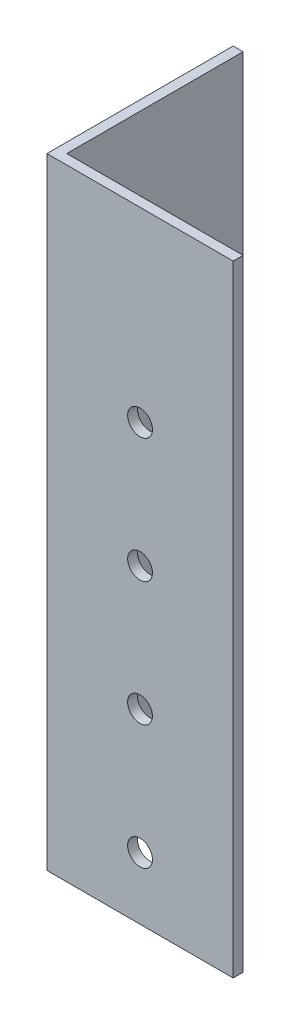
from build123d import *

# Parameters (mm, degrees)
EXTRUDE_1_DEPTH     = 250
SKETCH_6_R          = 5
CUT_EXTRUDE_1_DEPTH = 10
SKETCH_7_R          = 5
CUT_EXTRUDE_2_DEPTH = 10


with BuildPart() as part:
    # Эскиз1 → Вытянуть-Тонкостенный1 (new body)
    with BuildSketch(Plane(origin=(0, 0, 0), x_dir=(1, 0, 0), z_dir=(0, 1, 0))):
        Polygon((0, 75), (0, 0), (75, 0), (75, 4), (4, 4), (4, 75), align=None)
    extrude(amount=EXTRUDE_1_DEPTH)

    # Эскиз6 → Вырез-Вытянуть1 (cut)
    with BuildSketch(Plane.ZY):
        with Locations((-37.5, 25)):
            Circle(SKETCH_6_R)
        with Locations((-37.5, 75)):
            Circle(SKETCH_6_R)
        with Locations((-37.5, 125)):
            Circle(SKETCH_6_R)
        with Locations((-37.5, 175)):
            Circle(SKETCH_6_R)
    extrude(amount=-CUT_EXTRUDE_1_DEPTH, mode=Mode.SUBTRACT)

    # Эскиз7 → Вырез-Вытянуть2 (cut)
    with BuildSketch(Plane.XY):
        with Locations((37.5, 25)):
            Circle(SKETCH_7_R)
        with Locations((37.5, 75)):
            Circle(SKETCH_7_R)
        with Locations((37.5, 125)):
            Circle(SKETCH_7_R)
        with Locations((37.5, 175)):
            Circle(SKETCH_7_R)
    extrude(amount=-CUT_EXTRUDE_2_DEPTH, mode=Mode.SUBTRACT)


solid = part.part
